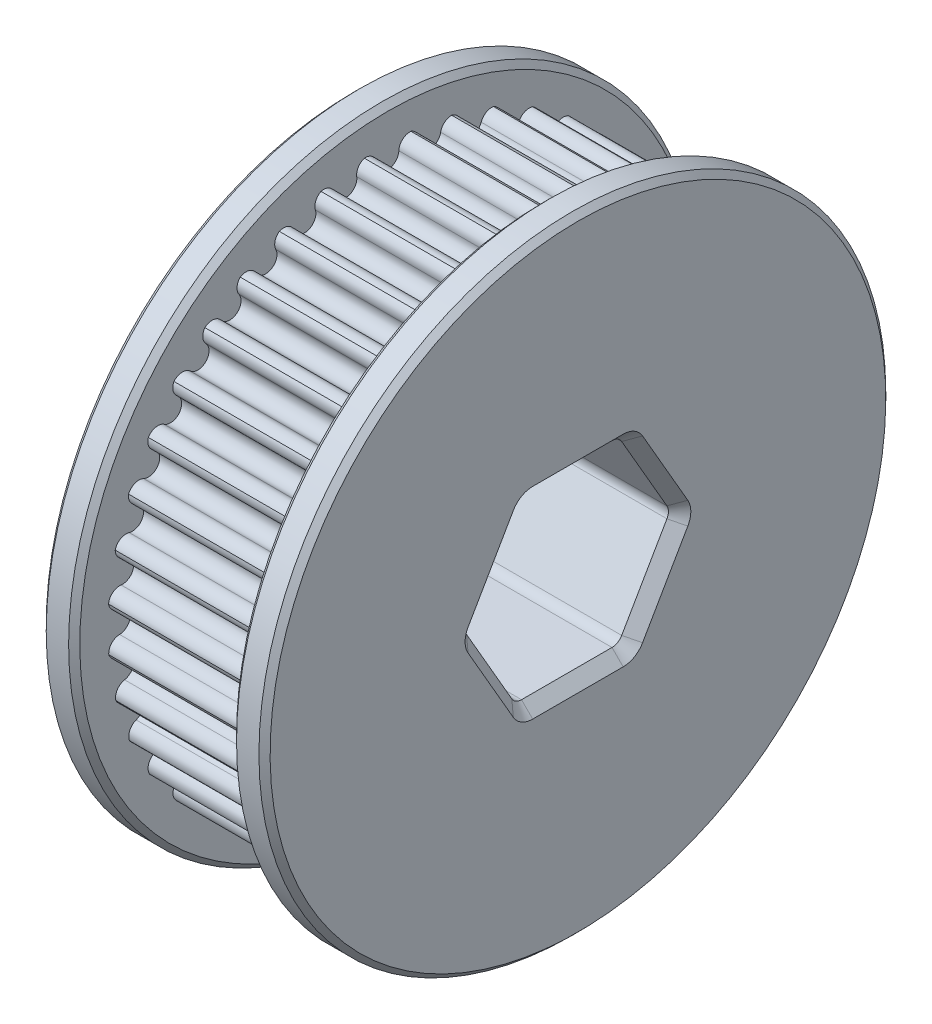
from build123d import *

# Parameters (mm, degrees)
CUT_EXTRUDE1_START       = -16.5
CUT_EXTRUDE1_OUTLINE_R   = 4
CUT_EXTRUDE1_DEPTH       = 9.5
CUT_EXTRUDE1_START_2     = -16.75
CUT_EXTRUDE1_2_OUTLINE_R = 14
CUT_EXTRUDE1_2_DEPTH     = 1
CUT_EXTRUDE1_START_3     = -8.25
CUT_EXTRUDE1_3_OUTLINE_R = 14
CUT_EXTRUDE1_3_DEPTH     = 1
SKETCH2_R                = 6.324330015
BOSS_EXTRUDE1_DEPTH      = 10
CUT_EXTRUDE2_REACH       = 24.181
CHAMFER1_SIZE            = 0.5
SKETCH4_R                = 5.8
SKETCH4_R_2              = 5.05
BOSS_EXTRUDE2_DEPTH      = 0.5


with BuildPart() as part:
    # Cut-Extrude1: read off the stored shape, not the designer's step
    # Cut-Extrude1 outline → Cut-Extrude1 (new body)
    with BuildSketch(Plane(origin=(17, 0, 0), x_dir=(0, 0, -1), z_dir=(1, 0, 0)).offset(CUT_EXTRUDE1_START)):
        with BuildLine():
            ThreePointArc((1.041143378, 12.456565356), (0.66686285, 12.331604355), (0.499748821, 11.974149369))
            ThreePointArc((0.499748821, 11.974149369), (0, 11.489995997), (-0.499748821, 11.974149369))
            ThreePointArc((-0.499748821, 11.974149369), (-0.66686285, 12.331604355), (-1.041143378, 12.456565356))
            ThreePointArc((-1.041143378, 12.456565356), (-1.309730051, 12.245866404), (-1.380507466, 11.9119152))
            ThreePointArc((-1.380507466, 11.9119152), (-1.793941124, 11.349100539), (-2.366765735, 11.748549781))
            ThreePointArc((-2.366765735, 11.748549781), (-2.587740592, 12.075461509), (-2.976961313, 12.140333659))
            ThreePointArc((-2.976961313, 12.140333659), (-3.20928066, 11.890212548), (-3.226945211, 11.54930081))
            ThreePointArc((-3.226945211, 11.54930081), (-3.547245203, 10.928740058), (-4.175505021, 11.233661906))
            ThreePointArc((-4.175505021, 11.233661906), (-4.444899572, 11.521980725), (-4.83947658, 11.525166655))
            ThreePointArc((-4.83947658, 11.525166655), (-5.029808129, 11.241782197), (-4.993924854, 10.902304304))
            ThreePointArc((-4.993924854, 10.902304304), (-5.213204333, 10.239277727), (-5.881429516, 10.442163992))
            ThreePointArc((-5.881429516, 10.442163992), (-6.192610373, 10.684790536), (-6.582827873, 10.626211799))
            ThreePointArc((-6.582827873, 10.626211799), (-6.726485029, 10.31654186), (-6.637937494, 9.986856884))
            ThreePointArc((-6.637937494, 9.986856884), (-6.750797071, 9.297690396), (-7.442533697, 9.393545346))
            ThreePointArc((-7.442533697, 9.393545346), (-7.787838555, 9.584505343), (-8.164088097, 9.465604342))
            ThreePointArc((-8.164088097, 9.465604342), (-8.257533543, 9.137274024), (-8.118502082, 8.825499903))
            ThreePointArc((-8.118502082, 8.825499903), (-8.122162779, 8.127163071), (-8.820377998, 8.113626438))
            ThreePointArc((-8.820377998, 8.113626438), (-9.191304305, 8.248217819), (-9.544321376, 8.071922291))
            ThreePointArc((-9.544321376, 8.071922291), (-9.585254176, 7.733016176), (-9.399162206, 7.446829824))
            ThreePointArc((-9.399162206, 7.446829824), (-9.293533885, 6.756518017), (-9.98103532, 6.633923119))
            ThreePointArc((-9.98103532, 6.633923119), (-10.36844964, 6.708831799), (-10.689541787, 6.479482724))
            ThreePointArc((-10.689541787, 6.479482724), (-10.67695404, 6.138345804), (-10.448383761, 5.88479408))
            ThreePointArc((-10.448383761, 5.88479408), (-10.236067343, 5.219505067), (-10.895926427, 4.990870596))
            ThreePointArc((-10.895926427, 4.990870596), (-11.290289332, 5.004252074), (-11.571550203, 4.727496789))
            ThreePointArc((-11.571550203, 4.727496789), (-11.50575186, 4.392528988), (-11.240331433, 4.177855175))
            ThreePointArc((-11.240331433, 4.177855175), (-10.926554851, 3.55397058), (-11.542523663, 3.224926275))
            ThreePointArc((-11.542523663, 3.224926275), (-11.934124632, 3.176451055), (-12.16862865, 2.859104193))
            ThreePointArc((-12.16862865, 2.859104193), (-12.051239885, 2.53855353), (-11.75550484, 2.368043611))
            ThreePointArc((-11.75550484, 2.368043611), (-11.347994316, 1.800925542), (-11.90490566, 1.379573567))
            ThreePointArc((-11.90490566, 1.379573567), (-12.284102175, 1.270435269), (-12.466075073, 0.920310963))
            ThreePointArc((-12.466075073, 0.920310963), (-12.299986388, 0.622070459), (-11.981218704, 0.499922953))
            ThreePointArc((-11.981218704, 0.499922953), (-11.490008498, 0.00353574), (-11.974149369, -0.499748821))
            ThreePointArc((-11.974149369, -0.499748821), (-12.331604355, -0.66686285), (-12.456565356, -1.041143378))
            ThreePointArc((-12.456565356, -1.041143378), (-12.245866404, -1.309730051), (-11.9119152, -1.380507466))
            ThreePointArc((-11.9119152, -1.380507466), (-11.349100539, -1.793941124), (-11.748549781, -2.366765735))
            ThreePointArc((-11.748549781, -2.366765735), (-12.075461509, -2.587740592), (-12.140333659, -2.976961313))
            ThreePointArc((-12.140333659, -2.976961313), (-11.890212548, -3.20928066), (-11.54930081, -3.226945211))
            ThreePointArc((-11.54930081, -3.226945211), (-10.928740058, -3.547245203), (-11.233661906, -4.175505021))
            ThreePointArc((-11.233661906, -4.175505021), (-11.521980725, -4.444899572), (-11.525166655, -4.83947658))
            ThreePointArc((-11.525166655, -4.83947658), (-11.241782197, -5.029808129), (-10.902304304, -4.993924854))
            ThreePointArc((-10.902304304, -4.993924854), (-10.239277727, -5.213204333), (-10.442163992, -5.881429516))
            ThreePointArc((-10.442163992, -5.881429516), (-10.684790536, -6.192610373), (-10.626211799, -6.582827873))
            ThreePointArc((-10.626211799, -6.582827873), (-10.31654186, -6.726485029), (-9.986856884, -6.637937494))
            ThreePointArc((-9.986856884, -6.637937494), (-9.297690396, -6.750797071), (-9.393545346, -7.442533697))
            ThreePointArc((-9.393545346, -7.442533697), (-9.584505343, -7.787838555), (-9.465604342, -8.164088097))
            ThreePointArc((-9.465604342, -8.164088097), (-9.137274024, -8.257533543), (-8.825499903, -8.118502082))
            ThreePointArc((-8.825499903, -8.118502082), (-8.127163071, -8.122162779), (-8.113626438, -8.820377998))
            ThreePointArc((-8.113626438, -8.820377998), (-8.248217819, -9.191304305), (-8.071922291, -9.544321376))
            ThreePointArc((-8.071922291, -9.544321376), (-7.733016176, -9.585254176), (-7.446829824, -9.399162206))
            ThreePointArc((-7.446829824, -9.399162206), (-6.756518017, -9.293533885), (-6.633923119, -9.98103532))
            ThreePointArc((-6.633923119, -9.98103532), (-6.708831799, -10.36844964), (-6.479482724, -10.689541787))
            ThreePointArc((-6.479482724, -10.689541787), (-6.138345804, -10.67695404), (-5.88479408, -10.448383761))
            ThreePointArc((-5.88479408, -10.448383761), (-5.219505067, -10.236067343), (-4.990870596, -10.895926427))
            ThreePointArc((-4.990870596, -10.895926427), (-5.004252074, -11.290289332), (-4.727496789, -11.571550203))
            ThreePointArc((-4.727496789, -11.571550203), (-4.392528988, -11.50575186), (-4.177855175, -11.240331433))
            ThreePointArc((-4.177855175, -11.240331433), (-3.55397058, -10.926554851), (-3.224926275, -11.542523663))
            ThreePointArc((-3.224926275, -11.542523663), (-3.176451055, -11.934124632), (-2.859104193, -12.16862865))
            ThreePointArc((-2.859104193, -12.16862865), (-2.53855353, -12.051239885), (-2.368043611, -11.75550484))
            ThreePointArc((-2.368043611, -11.75550484), (-1.800925542, -11.347994316), (-1.379573567, -11.90490566))
            ThreePointArc((-1.379573567, -11.90490566), (-1.270435269, -12.284102175), (-0.920310963, -12.466075073))
            ThreePointArc((-0.920310963, -12.466075073), (-0.622070459, -12.299986388), (-0.499922953, -11.981218704))
            ThreePointArc((-0.499922953, -11.981218704), (-0.00353574, -11.490008498), (0.499748821, -11.974149369))
            ThreePointArc((0.499748821, -11.974149369), (0.66686285, -12.331604355), (1.041143378, -12.456565356))
            ThreePointArc((1.041143378, -12.456565356), (1.309730051, -12.245866404), (1.380507466, -11.9119152))
            ThreePointArc((1.380507466, -11.9119152), (1.793941124, -11.349100539), (2.366765735, -11.748549781))
            ThreePointArc((2.366765735, -11.748549781), (2.587740592, -12.075461509), (2.976961313, -12.140333659))
            ThreePointArc((2.976961313, -12.140333659), (3.20928066, -11.890212548), (3.226945211, -11.54930081))
            ThreePointArc((3.226945211, -11.54930081), (3.547245203, -10.928740058), (4.175505021, -11.233661906))
            ThreePointArc((4.175505021, -11.233661906), (4.444899572, -11.521980725), (4.83947658, -11.525166655))
            ThreePointArc((4.83947658, -11.525166655), (5.029808129, -11.241782197), (4.993924854, -10.902304304))
            ThreePointArc((4.993924854, -10.902304304), (5.213204333, -10.239277727), (5.881429516, -10.442163992))
            ThreePointArc((5.881429516, -10.442163992), (6.192610373, -10.684790536), (6.582827873, -10.626211799))
            ThreePointArc((6.582827873, -10.626211799), (6.726485029, -10.31654186), (6.637937494, -9.986856884))
            ThreePointArc((6.637937494, -9.986856884), (6.750797071, -9.297690396), (7.442533697, -9.393545346))
            ThreePointArc((7.442533697, -9.393545346), (7.787838555, -9.584505343), (8.164088097, -9.465604342))
            ThreePointArc((8.164088097, -9.465604342), (8.257533543, -9.137274024), (8.118502082, -8.825499903))
            ThreePointArc((8.118502082, -8.825499903), (8.122162779, -8.127163071), (8.820377998, -8.113626438))
            ThreePointArc((8.820377998, -8.113626438), (9.191304305, -8.248217819), (9.544321376, -8.071922291))
            ThreePointArc((9.544321376, -8.071922291), (9.585254176, -7.733016176), (9.399162206, -7.446829824))
            ThreePointArc((9.399162206, -7.446829824), (9.293533885, -6.756518017), (9.98103532, -6.633923119))
            ThreePointArc((9.98103532, -6.633923119), (10.36844964, -6.708831799), (10.689541787, -6.479482724))
            ThreePointArc((10.689541787, -6.479482724), (10.67695404, -6.138345804), (10.448383761, -5.88479408))
            ThreePointArc((10.448383761, -5.88479408), (10.236067343, -5.219505067), (10.895926427, -4.990870596))
            ThreePointArc((10.895926427, -4.990870596), (11.290289332, -5.004252074), (11.571550203, -4.727496789))
            ThreePointArc((11.571550203, -4.727496789), (11.50575186, -4.392528988), (11.240331433, -4.177855175))
            ThreePointArc((11.240331433, -4.177855175), (10.926554851, -3.55397058), (11.542523663, -3.224926275))
            ThreePointArc((11.542523663, -3.224926275), (11.934124632, -3.176451055), (12.16862865, -2.859104193))
            ThreePointArc((12.16862865, -2.859104193), (12.051239885, -2.53855353), (11.75550484, -2.368043611))
            ThreePointArc((11.75550484, -2.368043611), (11.347994316, -1.800925542), (11.90490566, -1.379573567))
            ThreePointArc((11.90490566, -1.379573567), (12.284102175, -1.270435269), (12.466075073, -0.920310963))
            ThreePointArc((12.466075073, -0.920310963), (12.299986388, -0.622070459), (11.981218704, -0.499922953))
            ThreePointArc((11.981218704, -0.499922953), (11.490008498, -0.00353574), (11.974149369, 0.499748821))
            ThreePointArc((11.974149369, 0.499748821), (12.331604355, 0.66686285), (12.456565356, 1.041143378))
            ThreePointArc((12.456565356, 1.041143378), (12.245866404, 1.309730051), (11.9119152, 1.380507466))
            ThreePointArc((11.9119152, 1.380507466), (11.349100539, 1.793941124), (11.748549781, 2.366765735))
            ThreePointArc((11.748549781, 2.366765735), (12.075461509, 2.587740592), (12.140333659, 2.976961313))
            ThreePointArc((12.140333659, 2.976961313), (11.890212548, 3.20928066), (11.54930081, 3.226945211))
            ThreePointArc((11.54930081, 3.226945211), (10.928740058, 3.547245203), (11.233661906, 4.175505021))
            ThreePointArc((11.233661906, 4.175505021), (11.521980725, 4.444899572), (11.525166655, 4.83947658))
            ThreePointArc((11.525166655, 4.83947658), (11.241782197, 5.029808129), (10.902304304, 4.993924854))
            ThreePointArc((10.902304304, 4.993924854), (10.239277727, 5.213204333), (10.442163992, 5.881429516))
            ThreePointArc((10.442163992, 5.881429516), (10.684790536, 6.192610373), (10.626211799, 6.582827873))
            ThreePointArc((10.626211799, 6.582827873), (10.31654186, 6.726485029), (9.986856884, 6.637937494))
            ThreePointArc((9.986856884, 6.637937494), (9.297690396, 6.750797071), (9.393545346, 7.442533697))
            ThreePointArc((9.393545346, 7.442533697), (9.584505343, 7.787838555), (9.465604342, 8.164088097))
            ThreePointArc((9.465604342, 8.164088097), (9.137274024, 8.257533543), (8.825499903, 8.118502082))
            ThreePointArc((8.825499903, 8.118502082), (8.127163071, 8.122162779), (8.113626438, 8.820377998))
            ThreePointArc((8.113626438, 8.820377998), (8.248217819, 9.191304305), (8.071922291, 9.544321376))
            ThreePointArc((8.071922291, 9.544321376), (7.733016176, 9.585254176), (7.446829824, 9.399162206))
            ThreePointArc((7.446829824, 9.399162206), (6.756518017, 9.293533885), (6.633923119, 9.98103532))
            ThreePointArc((6.633923119, 9.98103532), (6.708831799, 10.36844964), (6.479482724, 10.689541787))
            ThreePointArc((6.479482724, 10.689541787), (6.138345804, 10.67695404), (5.88479408, 10.448383761))
            ThreePointArc((5.88479408, 10.448383761), (5.219505067, 10.236067343), (4.990870596, 10.895926427))
            ThreePointArc((4.990870596, 10.895926427), (5.004252074, 11.290289332), (4.727496789, 11.571550203))
            ThreePointArc((4.727496789, 11.571550203), (4.392528988, 11.50575186), (4.177855175, 11.240331433))
            ThreePointArc((4.177855175, 11.240331433), (3.55397058, 10.926554851), (3.224926275, 11.542523663))
            ThreePointArc((3.224926275, 11.542523663), (3.176451055, 11.934124632), (2.859104193, 12.16862865))
            ThreePointArc((2.859104193, 12.16862865), (2.53855353, 12.051239885), (2.368043611, 11.75550484))
            ThreePointArc((2.368043611, 11.75550484), (1.797431377, 11.34853508), (1.380507466, 11.9119152))
            ThreePointArc((1.380507466, 11.9119152), (1.309730051, 12.245866404), (1.041143378, 12.456565356))
        make_face()
        Circle(CUT_EXTRUDE1_OUTLINE_R, mode=Mode.SUBTRACT)
    extrude(amount=CUT_EXTRUDE1_DEPTH)

    # Cut-Extrude1 2 outline → Cut-Extrude1 2 (add)
    with BuildSketch(Plane(origin=(17, 0, 0), x_dir=(0, 0, -1), z_dir=(1, 0, 0)).offset(CUT_EXTRUDE1_START_2)):
        Circle(CUT_EXTRUDE1_2_OUTLINE_R)
        with BuildLine():
            ThreePointArc((-0.499748821, 11.974149369), (0, 11.489995997), (0.499748821, 11.974149369))
            ThreePointArc((0.499748821, 11.974149369), (0.66686285, 12.331604355), (1.041143378, 12.456565356))
            ThreePointArc((1.041143378, 12.456565356), (1.309730051, 12.245866404), (1.380507466, 11.9119152))
            ThreePointArc((1.380507466, 11.9119152), (1.797431377, 11.34853508), (2.368043611, 11.75550484))
            ThreePointArc((2.368043611, 11.75550484), (2.53855353, 12.051239885), (2.859104193, 12.16862865))
            ThreePointArc((2.859104193, 12.16862865), (3.176451055, 11.934124632), (3.224926275, 11.542523663))
            ThreePointArc((3.224926275, 11.542523663), (3.55397058, 10.926554851), (4.177855175, 11.240331433))
            ThreePointArc((4.177855175, 11.240331433), (4.392528988, 11.50575186), (4.727496789, 11.571550204))
            ThreePointArc((4.727496789, 11.571550204), (5.004252074, 11.290289332), (4.990870596, 10.895926427))
            ThreePointArc((4.990870596, 10.895926427), (5.219505067, 10.236067343), (5.88479408, 10.448383761))
            ThreePointArc((5.88479408, 10.448383761), (6.138345804, 10.67695404), (6.479482724, 10.689541788))
            ThreePointArc((6.479482724, 10.689541788), (6.708831799, 10.36844964), (6.633923119, 9.98103532))
            ThreePointArc((6.633923119, 9.98103532), (6.756518017, 9.293533885), (7.446829824, 9.399162206))
            ThreePointArc((7.446829824, 9.399162206), (7.733016176, 9.585254176), (8.071922291, 9.544321376))
            ThreePointArc((8.071922291, 9.544321376), (8.248217819, 9.191304305), (8.113626438, 8.820377998))
            ThreePointArc((8.113626438, 8.820377998), (8.127163071, 8.122162779), (8.825499903, 8.118502082))
            ThreePointArc((8.825499903, 8.118502082), (9.137274024, 8.257533543), (9.465604342, 8.164088097))
            ThreePointArc((9.465604342, 8.164088097), (9.584505343, 7.787838555), (9.393545346, 7.442533697))
            ThreePointArc((9.393545346, 7.442533697), (9.297690396, 6.750797071), (9.986856884, 6.637937494))
            ThreePointArc((9.986856884, 6.637937494), (10.31654186, 6.726485029), (10.626211799, 6.582827873))
            ThreePointArc((10.626211799, 6.582827873), (10.684790536, 6.192610373), (10.442163992, 5.881429516))
            ThreePointArc((10.442163992, 5.881429516), (10.239277727, 5.213204333), (10.902304304, 4.993924854))
            ThreePointArc((10.902304304, 4.993924854), (11.241782197, 5.029808129), (11.525166655, 4.83947658))
            ThreePointArc((11.525166655, 4.83947658), (11.521980725, 4.444899572), (11.233661906, 4.175505021))
            ThreePointArc((11.233661906, 4.175505021), (10.928740058, 3.547245203), (11.54930081, 3.226945211))
            ThreePointArc((11.54930081, 3.226945211), (11.890212548, 3.20928066), (12.140333659, 2.976961313))
            ThreePointArc((12.140333659, 2.976961313), (12.075461509, 2.587740592), (11.748549781, 2.366765735))
            ThreePointArc((11.748549781, 2.366765735), (11.349100539, 1.793941124), (11.9119152, 1.380507466))
            ThreePointArc((11.9119152, 1.380507466), (12.245866404, 1.309730051), (12.456565356, 1.041143378))
            ThreePointArc((12.456565356, 1.041143378), (12.331604355, 0.66686285), (11.974149369, 0.499748821))
            ThreePointArc((11.974149369, 0.499748821), (11.490008498, -0.00353574), (11.981218704, -0.499922953))
            ThreePointArc((11.981218704, -0.499922953), (12.299986388, -0.622070459), (12.466075073, -0.920310963))
            ThreePointArc((12.466075073, -0.920310963), (12.284102175, -1.270435269), (11.90490566, -1.379573567))
            ThreePointArc((11.90490566, -1.379573567), (11.347994316, -1.800925542), (11.75550484, -2.368043611))
            ThreePointArc((11.75550484, -2.368043611), (12.051239885, -2.53855353), (12.16862865, -2.859104193))
            ThreePointArc((12.16862865, -2.859104193), (11.934124632, -3.176451055), (11.542523663, -3.224926275))
            ThreePointArc((11.542523663, -3.224926275), (10.926554851, -3.55397058), (11.240331433, -4.177855175))
            ThreePointArc((11.240331433, -4.177855175), (11.50575186, -4.392528988), (11.571550204, -4.727496789))
            ThreePointArc((11.571550204, -4.727496789), (11.290289332, -5.004252074), (10.895926427, -4.990870596))
            ThreePointArc((10.895926427, -4.990870596), (10.236067343, -5.219505067), (10.448383761, -5.88479408))
            ThreePointArc((10.448383761, -5.88479408), (10.67695404, -6.138345804), (10.689541788, -6.479482724))
            ThreePointArc((10.689541788, -6.479482724), (10.36844964, -6.708831799), (9.98103532, -6.633923119))
            ThreePointArc((9.98103532, -6.633923119), (9.293533885, -6.756518017), (9.399162206, -7.446829824))
            ThreePointArc((9.399162206, -7.446829824), (9.585254176, -7.733016176), (9.544321376, -8.071922291))
            ThreePointArc((9.544321376, -8.071922291), (9.191304305, -8.248217819), (8.820377998, -8.113626438))
            ThreePointArc((8.820377998, -8.113626438), (8.122162779, -8.127163071), (8.118502082, -8.825499903))
            ThreePointArc((8.118502082, -8.825499903), (8.257533543, -9.137274024), (8.164088097, -9.465604342))
            ThreePointArc((8.164088097, -9.465604342), (7.787838555, -9.584505343), (7.442533697, -9.393545346))
            ThreePointArc((7.442533697, -9.393545346), (6.750797071, -9.297690396), (6.637937494, -9.986856884))
            ThreePointArc((6.637937494, -9.986856884), (6.726485029, -10.31654186), (6.582827873, -10.626211799))
            ThreePointArc((6.582827873, -10.626211799), (6.192610373, -10.684790536), (5.881429516, -10.442163992))
            ThreePointArc((5.881429516, -10.442163992), (5.213204333, -10.239277727), (4.993924854, -10.902304304))
            ThreePointArc((4.993924854, -10.902304304), (5.029808129, -11.241782197), (4.83947658, -11.525166655))
            ThreePointArc((4.83947658, -11.525166655), (4.444899572, -11.521980725), (4.175505021, -11.233661906))
            ThreePointArc((4.175505021, -11.233661906), (3.547245203, -10.928740058), (3.226945211, -11.54930081))
            ThreePointArc((3.226945211, -11.54930081), (3.20928066, -11.890212548), (2.976961313, -12.140333659))
            ThreePointArc((2.976961313, -12.140333659), (2.587740592, -12.075461509), (2.366765735, -11.748549781))
            ThreePointArc((2.366765735, -11.748549781), (1.793941124, -11.349100539), (1.380507466, -11.9119152))
            ThreePointArc((1.380507466, -11.9119152), (1.309730051, -12.245866404), (1.041143378, -12.456565356))
            ThreePointArc((1.041143378, -12.456565356), (0.66686285, -12.331604355), (0.499748821, -11.974149369))
            ThreePointArc((0.499748821, -11.974149369), (-0.00353574, -11.490008498), (-0.499922953, -11.981218704))
            ThreePointArc((-0.499922953, -11.981218704), (-0.622070459, -12.299986388), (-0.920310963, -12.466075073))
            ThreePointArc((-0.920310963, -12.466075073), (-1.270435269, -12.284102175), (-1.379573567, -11.90490566))
            ThreePointArc((-1.379573567, -11.90490566), (-1.800925542, -11.347994316), (-2.368043611, -11.75550484))
            ThreePointArc((-2.368043611, -11.75550484), (-2.53855353, -12.051239885), (-2.859104193, -12.16862865))
            ThreePointArc((-2.859104193, -12.16862865), (-3.176451055, -11.934124632), (-3.224926275, -11.542523663))
            ThreePointArc((-3.224926275, -11.542523663), (-3.55397058, -10.926554851), (-4.177855175, -11.240331433))
            ThreePointArc((-4.177855175, -11.240331433), (-4.392528988, -11.50575186), (-4.727496789, -11.571550204))
            ThreePointArc((-4.727496789, -11.571550204), (-5.004252074, -11.290289332), (-4.990870596, -10.895926427))
            ThreePointArc((-4.990870596, -10.895926427), (-5.219505067, -10.236067343), (-5.88479408, -10.448383761))
            ThreePointArc((-5.88479408, -10.448383761), (-6.138345804, -10.67695404), (-6.479482724, -10.689541788))
            ThreePointArc((-6.479482724, -10.689541788), (-6.708831799, -10.36844964), (-6.633923119, -9.98103532))
            ThreePointArc((-6.633923119, -9.98103532), (-6.756518017, -9.293533885), (-7.446829824, -9.399162206))
            ThreePointArc((-7.446829824, -9.399162206), (-7.733016176, -9.585254176), (-8.071922291, -9.544321376))
            ThreePointArc((-8.071922291, -9.544321376), (-8.248217819, -9.191304305), (-8.113626438, -8.820377998))
            ThreePointArc((-8.113626438, -8.820377998), (-8.127163071, -8.122162779), (-8.825499903, -8.118502082))
            ThreePointArc((-8.825499903, -8.118502082), (-9.137274024, -8.257533543), (-9.465604342, -8.164088097))
            ThreePointArc((-9.465604342, -8.164088097), (-9.584505343, -7.787838555), (-9.393545346, -7.442533697))
            ThreePointArc((-9.393545346, -7.442533697), (-9.297690396, -6.750797071), (-9.986856884, -6.637937494))
            ThreePointArc((-9.986856884, -6.637937494), (-10.31654186, -6.726485029), (-10.626211799, -6.582827873))
            ThreePointArc((-10.626211799, -6.582827873), (-10.684790536, -6.192610373), (-10.442163992, -5.881429516))
            ThreePointArc((-10.442163992, -5.881429516), (-10.239277727, -5.213204333), (-10.902304304, -4.993924854))
            ThreePointArc((-10.902304304, -4.993924854), (-11.241782197, -5.029808129), (-11.525166655, -4.83947658))
            ThreePointArc((-11.525166655, -4.83947658), (-11.521980725, -4.444899572), (-11.233661906, -4.175505021))
            ThreePointArc((-11.233661906, -4.175505021), (-10.928740058, -3.547245203), (-11.54930081, -3.226945211))
            ThreePointArc((-11.54930081, -3.226945211), (-11.890212548, -3.20928066), (-12.140333659, -2.976961313))
            ThreePointArc((-12.140333659, -2.976961313), (-12.075461509, -2.587740592), (-11.748549781, -2.366765735))
            ThreePointArc((-11.748549781, -2.366765735), (-11.349100539, -1.793941124), (-11.9119152, -1.380507466))
            ThreePointArc((-11.9119152, -1.380507466), (-12.245866404, -1.309730051), (-12.456565356, -1.041143378))
            ThreePointArc((-12.456565356, -1.041143378), (-12.331604355, -0.66686285), (-11.974149369, -0.499748821))
            ThreePointArc((-11.974149369, -0.499748821), (-11.490008498, 0.00353574), (-11.981218704, 0.499922953))
            ThreePointArc((-11.981218704, 0.499922953), (-12.299986388, 0.622070459), (-12.466075073, 0.920310963))
            ThreePointArc((-12.466075073, 0.920310963), (-12.284102175, 1.270435269), (-11.90490566, 1.379573567))
            ThreePointArc((-11.90490566, 1.379573567), (-11.347994316, 1.800925542), (-11.75550484, 2.368043611))
            ThreePointArc((-11.75550484, 2.368043611), (-12.051239885, 2.53855353), (-12.16862865, 2.859104193))
            ThreePointArc((-12.16862865, 2.859104193), (-11.934124632, 3.176451055), (-11.542523663, 3.224926275))
            ThreePointArc((-11.542523663, 3.224926275), (-10.926554851, 3.55397058), (-11.240331433, 4.177855175))
            ThreePointArc((-11.240331433, 4.177855175), (-11.50575186, 4.392528988), (-11.571550204, 4.727496789))
            ThreePointArc((-11.571550204, 4.727496789), (-11.290289332, 5.004252074), (-10.895926427, 4.990870596))
            ThreePointArc((-10.895926427, 4.990870596), (-10.236067343, 5.219505067), (-10.448383761, 5.88479408))
            ThreePointArc((-10.448383761, 5.88479408), (-10.67695404, 6.138345804), (-10.689541788, 6.479482724))
            ThreePointArc((-10.689541788, 6.479482724), (-10.36844964, 6.708831799), (-9.98103532, 6.633923119))
            ThreePointArc((-9.98103532, 6.633923119), (-9.293533885, 6.756518017), (-9.399162206, 7.446829824))
            ThreePointArc((-9.399162206, 7.446829824), (-9.585254176, 7.733016176), (-9.544321376, 8.071922291))
            ThreePointArc((-9.544321376, 8.071922291), (-9.191304305, 8.248217819), (-8.820377998, 8.113626438))
            ThreePointArc((-8.820377998, 8.113626438), (-8.122162779, 8.127163071), (-8.118502082, 8.825499903))
            ThreePointArc((-8.118502082, 8.825499903), (-8.257533543, 9.137274024), (-8.164088097, 9.465604342))
            ThreePointArc((-8.164088097, 9.465604342), (-7.787838555, 9.584505343), (-7.442533697, 9.393545346))
            ThreePointArc((-7.442533697, 9.393545346), (-6.750797071, 9.297690396), (-6.637937494, 9.986856884))
            ThreePointArc((-6.637937494, 9.986856884), (-6.726485029, 10.31654186), (-6.582827873, 10.626211799))
            ThreePointArc((-6.582827873, 10.626211799), (-6.192610373, 10.684790536), (-5.881429516, 10.442163992))
            ThreePointArc((-5.881429516, 10.442163992), (-5.213204333, 10.239277727), (-4.993924854, 10.902304304))
            ThreePointArc((-4.993924854, 10.902304304), (-5.029808129, 11.241782197), (-4.83947658, 11.525166655))
            ThreePointArc((-4.83947658, 11.525166655), (-4.444899572, 11.521980725), (-4.175505021, 11.233661906))
            ThreePointArc((-4.175505021, 11.233661906), (-3.547245203, 10.928740058), (-3.226945211, 11.54930081))
            ThreePointArc((-3.226945211, 11.54930081), (-3.20928066, 11.890212548), (-2.976961313, 12.140333659))
            ThreePointArc((-2.976961313, 12.140333659), (-2.587740592, 12.075461509), (-2.366765735, 11.748549781))
            ThreePointArc((-2.366765735, 11.748549781), (-1.793941124, 11.349100539), (-1.380507466, 11.9119152))
            ThreePointArc((-1.380507466, 11.9119152), (-1.309730051, 12.245866404), (-1.041143378, 12.456565356))
            ThreePointArc((-1.041143378, 12.456565356), (-0.66686285, 12.331604355), (-0.499748821, 11.974149369))
        make_face(mode=Mode.SUBTRACT)
    extrude(amount=CUT_EXTRUDE1_2_DEPTH)

    # Cut-Extrude1 3 outline → Cut-Extrude1 3 (add)
    with BuildSketch(Plane(origin=(17, 0, 0), x_dir=(0, 0, -1), z_dir=(1, 0, 0)).offset(CUT_EXTRUDE1_START_3)):
        Circle(CUT_EXTRUDE1_3_OUTLINE_R)
        with BuildLine():
            ThreePointArc((-0.499748821, 11.974149369), (0, 11.489995997), (0.499748821, 11.974149369))
            ThreePointArc((0.499748821, 11.974149369), (0.66686285, 12.331604355), (1.041143378, 12.456565356))
            ThreePointArc((1.041143378, 12.456565356), (1.309730051, 12.245866404), (1.380507466, 11.9119152))
            ThreePointArc((1.380507466, 11.9119152), (1.797431377, 11.34853508), (2.368043611, 11.75550484))
            ThreePointArc((2.368043611, 11.75550484), (2.53855353, 12.051239885), (2.859104193, 12.16862865))
            ThreePointArc((2.859104193, 12.16862865), (3.176451055, 11.934124632), (3.224926275, 11.542523663))
            ThreePointArc((3.224926275, 11.542523663), (3.55397058, 10.926554851), (4.177855175, 11.240331433))
            ThreePointArc((4.177855175, 11.240331433), (4.392528988, 11.50575186), (4.727496789, 11.571550204))
            ThreePointArc((4.727496789, 11.571550204), (5.004252074, 11.290289332), (4.990870596, 10.895926427))
            ThreePointArc((4.990870596, 10.895926427), (5.219505067, 10.236067343), (5.88479408, 10.448383761))
            ThreePointArc((5.88479408, 10.448383761), (6.138345804, 10.67695404), (6.479482724, 10.689541788))
            ThreePointArc((6.479482724, 10.689541788), (6.708831799, 10.36844964), (6.633923119, 9.98103532))
            ThreePointArc((6.633923119, 9.98103532), (6.756518017, 9.293533885), (7.446829824, 9.399162206))
            ThreePointArc((7.446829824, 9.399162206), (7.733016176, 9.585254176), (8.071922291, 9.544321376))
            ThreePointArc((8.071922291, 9.544321376), (8.248217819, 9.191304305), (8.113626438, 8.820377998))
            ThreePointArc((8.113626438, 8.820377998), (8.127163071, 8.122162779), (8.825499903, 8.118502082))
            ThreePointArc((8.825499903, 8.118502082), (9.137274024, 8.257533543), (9.465604342, 8.164088097))
            ThreePointArc((9.465604342, 8.164088097), (9.584505343, 7.787838555), (9.393545346, 7.442533697))
            ThreePointArc((9.393545346, 7.442533697), (9.297690396, 6.750797071), (9.986856884, 6.637937494))
            ThreePointArc((9.986856884, 6.637937494), (10.31654186, 6.726485029), (10.626211799, 6.582827873))
            ThreePointArc((10.626211799, 6.582827873), (10.684790536, 6.192610373), (10.442163992, 5.881429516))
            ThreePointArc((10.442163992, 5.881429516), (10.239277727, 5.213204333), (10.902304304, 4.993924854))
            ThreePointArc((10.902304304, 4.993924854), (11.241782197, 5.029808129), (11.525166655, 4.83947658))
            ThreePointArc((11.525166655, 4.83947658), (11.521980725, 4.444899572), (11.233661906, 4.175505021))
            ThreePointArc((11.233661906, 4.175505021), (10.928740058, 3.547245203), (11.54930081, 3.226945211))
            ThreePointArc((11.54930081, 3.226945211), (11.890212548, 3.20928066), (12.140333659, 2.976961313))
            ThreePointArc((12.140333659, 2.976961313), (12.075461509, 2.587740592), (11.748549781, 2.366765735))
            ThreePointArc((11.748549781, 2.366765735), (11.349100539, 1.793941124), (11.9119152, 1.380507466))
            ThreePointArc((11.9119152, 1.380507466), (12.245866404, 1.309730051), (12.456565356, 1.041143378))
            ThreePointArc((12.456565356, 1.041143378), (12.331604355, 0.66686285), (11.974149369, 0.499748821))
            ThreePointArc((11.974149369, 0.499748821), (11.490008498, -0.00353574), (11.981218704, -0.499922953))
            ThreePointArc((11.981218704, -0.499922953), (12.299986388, -0.622070459), (12.466075073, -0.920310963))
            ThreePointArc((12.466075073, -0.920310963), (12.284102175, -1.270435269), (11.90490566, -1.379573567))
            ThreePointArc((11.90490566, -1.379573567), (11.347994316, -1.800925542), (11.75550484, -2.368043611))
            ThreePointArc((11.75550484, -2.368043611), (12.051239885, -2.53855353), (12.16862865, -2.859104193))
            ThreePointArc((12.16862865, -2.859104193), (11.934124632, -3.176451055), (11.542523663, -3.224926275))
            ThreePointArc((11.542523663, -3.224926275), (10.926554851, -3.55397058), (11.240331433, -4.177855175))
            ThreePointArc((11.240331433, -4.177855175), (11.50575186, -4.392528988), (11.571550204, -4.727496789))
            ThreePointArc((11.571550204, -4.727496789), (11.290289332, -5.004252074), (10.895926427, -4.990870596))
            ThreePointArc((10.895926427, -4.990870596), (10.236067343, -5.219505067), (10.448383761, -5.88479408))
            ThreePointArc((10.448383761, -5.88479408), (10.67695404, -6.138345804), (10.689541788, -6.479482724))
            ThreePointArc((10.689541788, -6.479482724), (10.36844964, -6.708831799), (9.98103532, -6.633923119))
            ThreePointArc((9.98103532, -6.633923119), (9.293533885, -6.756518017), (9.399162206, -7.446829824))
            ThreePointArc((9.399162206, -7.446829824), (9.585254176, -7.733016176), (9.544321376, -8.071922291))
            ThreePointArc((9.544321376, -8.071922291), (9.191304305, -8.248217819), (8.820377998, -8.113626438))
            ThreePointArc((8.820377998, -8.113626438), (8.122162779, -8.127163071), (8.118502082, -8.825499903))
            ThreePointArc((8.118502082, -8.825499903), (8.257533543, -9.137274024), (8.164088097, -9.465604342))
            ThreePointArc((8.164088097, -9.465604342), (7.787838555, -9.584505343), (7.442533697, -9.393545346))
            ThreePointArc((7.442533697, -9.393545346), (6.750797071, -9.297690396), (6.637937494, -9.986856884))
            ThreePointArc((6.637937494, -9.986856884), (6.726485029, -10.31654186), (6.582827873, -10.626211799))
            ThreePointArc((6.582827873, -10.626211799), (6.192610373, -10.684790536), (5.881429516, -10.442163992))
            ThreePointArc((5.881429516, -10.442163992), (5.213204333, -10.239277727), (4.993924854, -10.902304304))
            ThreePointArc((4.993924854, -10.902304304), (5.029808129, -11.241782197), (4.83947658, -11.525166655))
            ThreePointArc((4.83947658, -11.525166655), (4.444899572, -11.521980725), (4.175505021, -11.233661906))
            ThreePointArc((4.175505021, -11.233661906), (3.547245203, -10.928740058), (3.226945211, -11.54930081))
            ThreePointArc((3.226945211, -11.54930081), (3.20928066, -11.890212548), (2.976961313, -12.140333659))
            ThreePointArc((2.976961313, -12.140333659), (2.587740592, -12.075461509), (2.366765735, -11.748549781))
            ThreePointArc((2.366765735, -11.748549781), (1.793941124, -11.349100539), (1.380507466, -11.9119152))
            ThreePointArc((1.380507466, -11.9119152), (1.309730051, -12.245866404), (1.041143378, -12.456565356))
            ThreePointArc((1.041143378, -12.456565356), (0.66686285, -12.331604355), (0.499748821, -11.974149369))
            ThreePointArc((0.499748821, -11.974149369), (-0.00353574, -11.490008498), (-0.499922953, -11.981218704))
            ThreePointArc((-0.499922953, -11.981218704), (-0.622070459, -12.299986388), (-0.920310963, -12.466075073))
            ThreePointArc((-0.920310963, -12.466075073), (-1.270435269, -12.284102175), (-1.379573567, -11.90490566))
            ThreePointArc((-1.379573567, -11.90490566), (-1.800925542, -11.347994316), (-2.368043611, -11.75550484))
            ThreePointArc((-2.368043611, -11.75550484), (-2.53855353, -12.051239885), (-2.859104193, -12.16862865))
            ThreePointArc((-2.859104193, -12.16862865), (-3.176451055, -11.934124632), (-3.224926275, -11.542523663))
            ThreePointArc((-3.224926275, -11.542523663), (-3.55397058, -10.926554851), (-4.177855175, -11.240331433))
            ThreePointArc((-4.177855175, -11.240331433), (-4.392528988, -11.50575186), (-4.727496789, -11.571550204))
            ThreePointArc((-4.727496789, -11.571550204), (-5.004252074, -11.290289332), (-4.990870596, -10.895926427))
            ThreePointArc((-4.990870596, -10.895926427), (-5.219505067, -10.236067343), (-5.88479408, -10.448383761))
            ThreePointArc((-5.88479408, -10.448383761), (-6.138345804, -10.67695404), (-6.479482724, -10.689541788))
            ThreePointArc((-6.479482724, -10.689541788), (-6.708831799, -10.36844964), (-6.633923119, -9.98103532))
            ThreePointArc((-6.633923119, -9.98103532), (-6.756518017, -9.293533885), (-7.446829824, -9.399162206))
            ThreePointArc((-7.446829824, -9.399162206), (-7.733016176, -9.585254176), (-8.071922291, -9.544321376))
            ThreePointArc((-8.071922291, -9.544321376), (-8.248217819, -9.191304305), (-8.113626438, -8.820377998))
            ThreePointArc((-8.113626438, -8.820377998), (-8.127163071, -8.122162779), (-8.825499903, -8.118502082))
            ThreePointArc((-8.825499903, -8.118502082), (-9.137274024, -8.257533543), (-9.465604342, -8.164088097))
            ThreePointArc((-9.465604342, -8.164088097), (-9.584505343, -7.787838555), (-9.393545346, -7.442533697))
            ThreePointArc((-9.393545346, -7.442533697), (-9.297690396, -6.750797071), (-9.986856884, -6.637937494))
            ThreePointArc((-9.986856884, -6.637937494), (-10.31654186, -6.726485029), (-10.626211799, -6.582827873))
            ThreePointArc((-10.626211799, -6.582827873), (-10.684790536, -6.192610373), (-10.442163992, -5.881429516))
            ThreePointArc((-10.442163992, -5.881429516), (-10.239277727, -5.213204333), (-10.902304304, -4.993924854))
            ThreePointArc((-10.902304304, -4.993924854), (-11.241782197, -5.029808129), (-11.525166655, -4.83947658))
            ThreePointArc((-11.525166655, -4.83947658), (-11.521980725, -4.444899572), (-11.233661906, -4.175505021))
            ThreePointArc((-11.233661906, -4.175505021), (-10.928740058, -3.547245203), (-11.54930081, -3.226945211))
            ThreePointArc((-11.54930081, -3.226945211), (-11.890212548, -3.20928066), (-12.140333659, -2.976961313))
            ThreePointArc((-12.140333659, -2.976961313), (-12.075461509, -2.587740592), (-11.748549781, -2.366765735))
            ThreePointArc((-11.748549781, -2.366765735), (-11.349100539, -1.793941124), (-11.9119152, -1.380507466))
            ThreePointArc((-11.9119152, -1.380507466), (-12.245866404, -1.309730051), (-12.456565356, -1.041143378))
            ThreePointArc((-12.456565356, -1.041143378), (-12.331604355, -0.66686285), (-11.974149369, -0.499748821))
            ThreePointArc((-11.974149369, -0.499748821), (-11.490008498, 0.00353574), (-11.981218704, 0.499922953))
            ThreePointArc((-11.981218704, 0.499922953), (-12.299986388, 0.622070459), (-12.466075073, 0.920310963))
            ThreePointArc((-12.466075073, 0.920310963), (-12.284102175, 1.270435269), (-11.90490566, 1.379573567))
            ThreePointArc((-11.90490566, 1.379573567), (-11.347994316, 1.800925542), (-11.75550484, 2.368043611))
            ThreePointArc((-11.75550484, 2.368043611), (-12.051239885, 2.53855353), (-12.16862865, 2.859104193))
            ThreePointArc((-12.16862865, 2.859104193), (-11.934124632, 3.176451055), (-11.542523663, 3.224926275))
            ThreePointArc((-11.542523663, 3.224926275), (-10.926554851, 3.55397058), (-11.240331433, 4.177855175))
            ThreePointArc((-11.240331433, 4.177855175), (-11.50575186, 4.392528988), (-11.571550204, 4.727496789))
            ThreePointArc((-11.571550204, 4.727496789), (-11.290289332, 5.004252074), (-10.895926427, 4.990870596))
            ThreePointArc((-10.895926427, 4.990870596), (-10.236067343, 5.219505067), (-10.448383761, 5.88479408))
            ThreePointArc((-10.448383761, 5.88479408), (-10.67695404, 6.138345804), (-10.689541788, 6.479482724))
            ThreePointArc((-10.689541788, 6.479482724), (-10.36844964, 6.708831799), (-9.98103532, 6.633923119))
            ThreePointArc((-9.98103532, 6.633923119), (-9.293533885, 6.756518017), (-9.399162206, 7.446829824))
            ThreePointArc((-9.399162206, 7.446829824), (-9.585254176, 7.733016176), (-9.544321376, 8.071922291))
            ThreePointArc((-9.544321376, 8.071922291), (-9.191304305, 8.248217819), (-8.820377998, 8.113626438))
            ThreePointArc((-8.820377998, 8.113626438), (-8.122162779, 8.127163071), (-8.118502082, 8.825499903))
            ThreePointArc((-8.118502082, 8.825499903), (-8.257533543, 9.137274024), (-8.164088097, 9.465604342))
            ThreePointArc((-8.164088097, 9.465604342), (-7.787838555, 9.584505343), (-7.442533697, 9.393545346))
            ThreePointArc((-7.442533697, 9.393545346), (-6.750797071, 9.297690396), (-6.637937494, 9.986856884))
            ThreePointArc((-6.637937494, 9.986856884), (-6.726485029, 10.31654186), (-6.582827873, 10.626211799))
            ThreePointArc((-6.582827873, 10.626211799), (-6.192610373, 10.684790536), (-5.881429516, 10.442163992))
            ThreePointArc((-5.881429516, 10.442163992), (-5.213204333, 10.239277727), (-4.993924854, 10.902304304))
            ThreePointArc((-4.993924854, 10.902304304), (-5.029808129, 11.241782197), (-4.83947658, 11.525166655))
            ThreePointArc((-4.83947658, 11.525166655), (-4.444899572, 11.521980725), (-4.175505021, 11.233661906))
            ThreePointArc((-4.175505021, 11.233661906), (-3.547245203, 10.928740058), (-3.226945211, 11.54930081))
            ThreePointArc((-3.226945211, 11.54930081), (-3.20928066, 11.890212548), (-2.976961313, 12.140333659))
            ThreePointArc((-2.976961313, 12.140333659), (-2.587740592, 12.075461509), (-2.366765735, 11.748549781))
            ThreePointArc((-2.366765735, 11.748549781), (-1.793941124, 11.349100539), (-1.380507466, 11.9119152))
            ThreePointArc((-1.380507466, 11.9119152), (-1.309730051, 12.245866404), (-1.041143378, 12.456565356))
            ThreePointArc((-1.041143378, 12.456565356), (-0.66686285, 12.331604355), (-0.499748821, 11.974149369))
        make_face(mode=Mode.SUBTRACT)
    extrude(amount=CUT_EXTRUDE1_3_DEPTH)

    # Cut-Extrude1 4 outline → Cut-Extrude1 4 (revolve)
    with BuildSketch(Plane.YX):
        Polygon((4, 0.5), (4.5, 0), (13.75, 0), (14, 0.25), (12.500000001, 0.25), (12.500000001, 0.5), align=None)
        Polygon((11.489995997, 1.5), (11.489995997, 1.25), (14, 1.25), (13.75, 1.5), align=None)
        Polygon((11.489995997, 8.75), (11.489995997, 8.5), (13.75, 8.5), (14, 8.75), align=None)
        Polygon((11.489995997, 10), (11.489995997, 9.75), (14, 9.75), (13.75, 10), align=None)
    revolve(axis=Axis((0, 0, 0), (1, 0, 0)))

    # Sketch2 → Boss-Extrude1 (add)
    with BuildSketch(Plane(origin=(10, 0, 0), x_dir=(0, 0, -1), z_dir=(1, 0, 0))):
        Circle(SKETCH2_R)
    extrude(amount=-BOSS_EXTRUDE1_DEPTH)

    # Sketch3 → Cut-Extrude2 (cut, up to next)
    with BuildSketch(Plane.ZY, mode=Mode.PRIVATE) as cut_extrude2_sk1:
        with BuildLine():
            Line((4.474464586, 0.25), (2.453738644, 3.75))
            ThreePointArc((2.453738644, 3.75), (2.270725942, 3.933012702), (2.020725942, 4))
            Line((2.020725942, 4), (-2.020725942, 4))
            ThreePointArc((-2.020725942, 4), (-2.270725942, 3.933012702), (-2.453738644, 3.75))
            Line((-2.453738644, 3.75), (-4.474464586, 0.25))
            ThreePointArc((-4.474464586, 0.25), (-4.541451884, 0), (-4.474464586, -0.25))
            Line((-4.474464586, -0.25), (-2.453738644, -3.75))
            ThreePointArc((-2.453738644, -3.75), (-2.270725942, -3.933012702), (-2.020725942, -4))
            Line((-2.020725942, -4), (2.020725942, -4))
            ThreePointArc((2.020725942, -4), (2.270725942, -3.933012702), (2.453738644, -3.75))
            Line((2.453738644, -3.75), (4.474464586, -0.25))
            ThreePointArc((4.474464586, -0.25), (4.541451884, 0), (4.474464586, 0.25))
        make_face()
    cut_extrude2_tool1 = extrude(cut_extrude2_sk1.sketch, amount=-CUT_EXTRUDE2_REACH, mode=Mode.PRIVATE) & part.part
    add(cut_extrude2_tool1.solids().sort_by_distance((0, 0, 0))[0], mode=Mode.SUBTRACT)

    # Chamfer1
    chamfer1_edges = [part.edges().sort_by_distance(p)[0] for p in [
        (10, -3.933012702, -2.270725942),
        (10, -2, -3.464101615),
        (10, 0, -4.541451884),
        (10, 2, -3.464101615),
        (10, 3.933012702, -2.270725942),
        (10, 4, 0),
        (10, 3.933012702, 2.270725942),
        (10, 2, 3.464101615),
        (10, 0, 4.541451884),
        (10, -2, 3.464101615),
        (10, -3.933012702, 2.270725942),
        (10, -4, 0),
        (0, -3.933012702, -2.270725942),
        (0, -4, 0),
        (0, -3.933012702, 2.270725942),
        (0, -2, 3.464101615),
        (0, 0, 4.541451884),
        (0, 2, 3.464101615),
        (0, 3.933012702, 2.270725942),
        (0, 4, 0),
        (0, 3.933012702, -2.270725942),
        (0, 2, -3.464101615),
        (0, 0, -4.541451884),
        (0, -2, -3.464101615),
    ]]
    chamfer(chamfer1_edges, length=CHAMFER1_SIZE)

    # Sketch4 → Boss-Extrude2 (add)
    with BuildSketch(Plane.ZY):
        Circle(SKETCH4_R)
        Circle(SKETCH4_R_2, mode=Mode.SUBTRACT)
    extrude(amount=BOSS_EXTRUDE2_DEPTH)


solid = part.part
